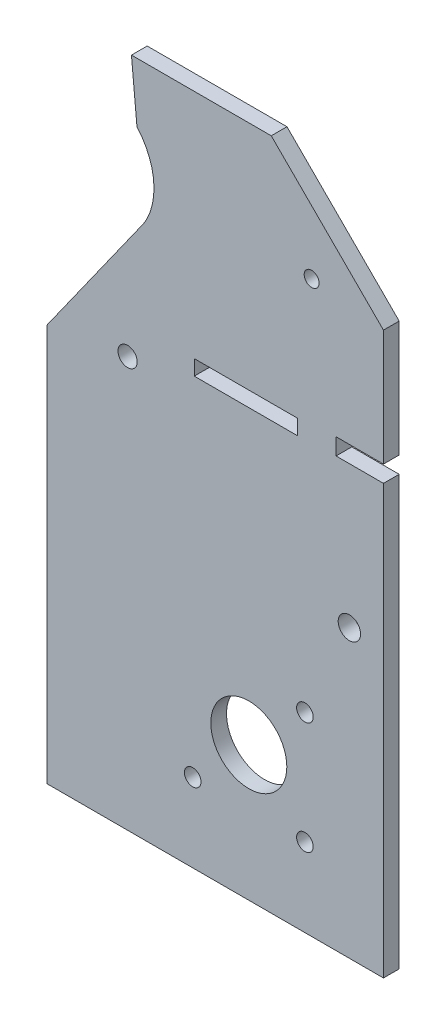
from build123d import *

# Parameters (mm, degrees)
SKETCH1_W            = 150
SKETCH1_H            = 300
BOSS_EXTRUDE1_DEPTH  = 7
CHAMFER1_SIZE        = 50
SKETCH2_R            = 3.325255306
SKETCH2_R_2          = 4.992144286
SKETCH2_W            = 21.115622252
SKETCH2_H            = 7.424048867
CUT_EXTRUDE1_DEPTH   = 10
SKETCH3_R            = 30
CUT_EXTRUDE2_DEPTH   = 10
CUT_EXTRUDE3_DEPTH   = 10
SKETCH5_R            = 16.935062279
CUT_EXTRUDE4_DEPTH   = 10
SKETCH6_R            = 3.705491154
CUT_EXTRUDE5_DEPTH   = 10
LPATTERN1_COUNT      = 2
LPATTERN1_PITCH      = 50
LPATTERN1_COUNT_DIR2 = 2
LPATTERN1_PITCH_DIR2 = 50
SKETCH7_R            = 4.289450457
CUT_EXTRUDE6_DEPTH   = 10
SKETCH8_W            = 46.029102976
SKETCH8_H            = 6.764133413
CUT_EXTRUDE7_DEPTH   = 10


with BuildPart() as part:
    # Sketch1 → Boss-Extrude1 (new body)
    with BuildSketch(Plane.XY):
        with Locations((61.676783005, -136.737481032)):
            Rectangle(SKETCH1_W, SKETCH1_H)
    extrude(amount=BOSS_EXTRUDE1_DEPTH)

    # Chamfer1
    chamfer1_edges = [part.edges().sort_by_distance(p)[0] for p in [
        (136.676783005, 13.262518968, 3.5),
    ]]
    chamfer(chamfer1_edges, length=CHAMFER1_SIZE)

    # Sketch2 → Cut-Extrude1 (cut)
    with BuildSketch(Plane.XY.offset(7)):
        with Locations((104.672555747, -32.954371461)):
            Circle(SKETCH2_R)
        with Locations((121.500399846, -159.163202203)):
            Circle(SKETCH2_R_2)
        with Locations((126.118971879, -92.146240965)):
            Rectangle(SKETCH2_W, SKETCH2_H)
    extrude(amount=-CUT_EXTRUDE1_DEPTH, mode=Mode.SUBTRACT)

    # Sketch3 → Cut-Extrude2 (cut)
    with BuildSketch(Plane.XY.offset(7)):
        with Locations((4.429117296, -33.119350325)):
            Circle(SKETCH3_R)
    extrude(amount=-CUT_EXTRUDE2_DEPTH, mode=Mode.SUBTRACT)

    # Sketch4 → Cut-Extrude3 (cut)
    with BuildSketch(Plane.XY.offset(7)):
        Polygon((-13.323216995, -109.834521952), (30.135373578, -48.58506686), (24.391559805, 13.262518968), (-24.505894541, 18.024097427), align=None)
    extrude(amount=-CUT_EXTRUDE3_DEPTH, mode=Mode.SUBTRACT)

    # Sketch5 → Cut-Extrude4 (cut)
    with BuildSketch(Plane.XY.offset(7)):
        with Locations((76.676783005, -226.737481032)):
            Circle(SKETCH5_R)
    extrude(amount=-CUT_EXTRUDE4_DEPTH, mode=Mode.SUBTRACT)

    # Sketch6 → Cut-Extrude5 (cut)
    with BuildSketch(Plane.XY.offset(7)):
        with Locations((51.676783005, -251.737481032)):
            Circle(SKETCH6_R)
    cut_extrude5 = extrude(amount=-CUT_EXTRUDE5_DEPTH, mode=Mode.SUBTRACT)

    # LPattern1: Cut-Extrude5 2 × 2, 1 skipped
    with Locations(*[(j * LPATTERN1_PITCH_DIR2, i * LPATTERN1_PITCH, 0) for i in range(LPATTERN1_COUNT) for j in range(LPATTERN1_COUNT_DIR2) if (i, j) not in ((0, 0), (1, 0))]):
        add(cut_extrude5, mode=Mode.SUBTRACT)

    # Sketch7 → Cut-Extrude6 (cut)
    with BuildSketch(Plane.XY.offset(7)):
        with Locations((22.678060481, -103.895282858)):
            Circle(SKETCH7_R)
    extrude(amount=-CUT_EXTRUDE6_DEPTH, mode=Mode.SUBTRACT)

    # Sketch8 → Cut-Extrude7 (cut)
    with BuildSketch(Plane.XY.offset(7)):
        with Locations((75.388807438, -93.254146149)):
            Rectangle(SKETCH8_W, SKETCH8_H)
    extrude(amount=-CUT_EXTRUDE7_DEPTH, mode=Mode.SUBTRACT)


solid = part.part
